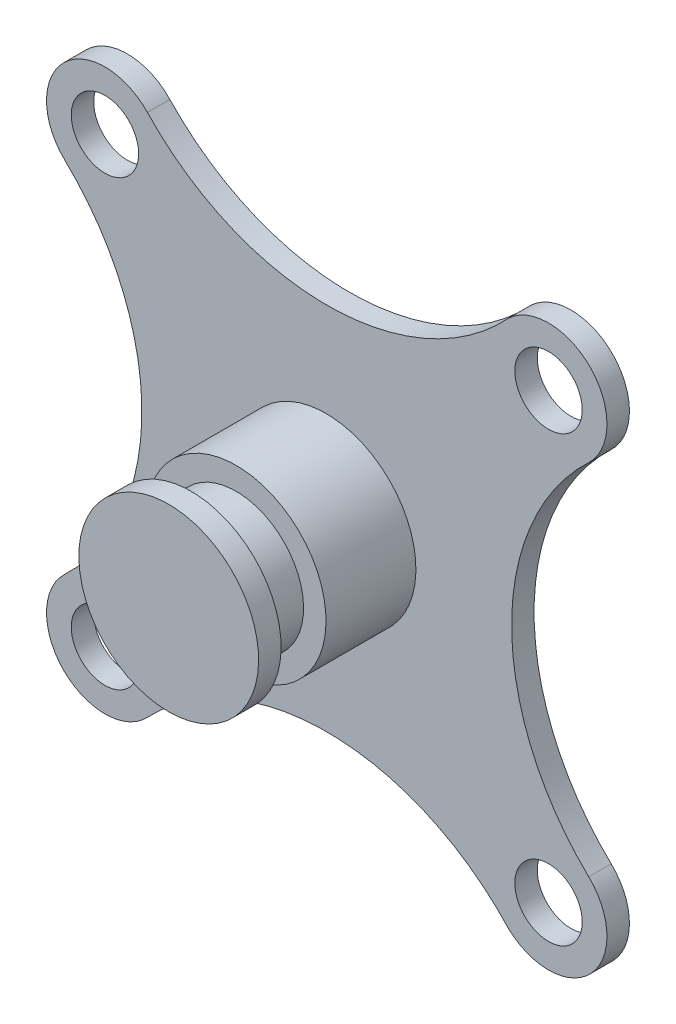
from build123d import *

# Parameters (mm, degrees)
SKETCH1_R             = 7.5
BOSS_EXTRUDE1_DEPTH   = 5
SKETCH3_R             = 20
BOSS_EXTRUDE2_DEPTH   = 20
SKETCH4_R             = 15
BOSS_EXTRUDE3_DEPTH   = 10
SKETCH5_R             = 20
BOSS_EXTRUDE4_DEPTH   = 5
BODY_MOVE_COPY1_ANGLE = 90


with BuildPart() as part:
    # Sketch1 → Boss-Extrude1 (new body)
    with BuildSketch(Plane(origin=(0, 0, 0), x_dir=(1, 0, 0), z_dir=(0, 1, 0))):
        with BuildLine():
            ThreePointArc((-39.749220484, 58.127463165), (-58.377062168, 58.381791069), (-58.131919931, 39.753826237))
            ThreePointArc((-58.131919931, 39.753826237), (-40.976062677, -0.15633362), (-58.131919931, -40.066493476))
            ThreePointArc((-58.131919931, -40.066493476), (-58.377062168, -58.694458308), (-39.749220484, -58.440130404))
            ThreePointArc((-39.749220484, -58.440130404), (0.58615995, -41.266091018), (40.663235765, -59.034561344))
            ThreePointArc((40.663235765, -59.034561344), (58.984188278, -58.390820393), (58.444979195, -40.066493476))
            ThreePointArc((58.444979195, -40.066493476), (41.289121941, -0.15633362), (58.444979195, 39.753826237))
            ThreePointArc((58.444979195, 39.753826237), (58.984188278, 58.078153154), (40.663235765, 58.721894105))
            ThreePointArc((40.663235765, 58.721894105), (0.58615995, 40.953423779), (-39.749220484, 58.127463165))
        make_face()
        with Locations(Location((-49.186940736, 49.187136748, 0), (0, 0, 270))):
            Circle(SKETCH1_R, mode=Mode.SUBTRACT)
        with Locations(Location((49.5, 49.187136748, 0), (0, 0, 270))):
            Circle(SKETCH1_R, mode=Mode.SUBTRACT)
        with Locations(Location((-49.186940736, -49.499803987, 0), (0, 0, 270))):
            Circle(SKETCH1_R, mode=Mode.SUBTRACT)
        with Locations(Location((49.5, -49.499803987, 0), (0, 0, 270))):
            Circle(SKETCH1_R, mode=Mode.SUBTRACT)
    extrude(amount=BOSS_EXTRUDE1_DEPTH)

    # Sketch3 → Boss-Extrude2 (add)
    with BuildSketch(Plane(origin=(0, 5, 0), x_dir=(1, 0, 0), z_dir=(0, 1, 0))):
        with Locations(Location((0, 0, 0), (0, 0, 270))):
            Circle(SKETCH3_R)
    extrude(amount=BOSS_EXTRUDE2_DEPTH)

    # Sketch4 → Boss-Extrude3 (add)
    with BuildSketch(Plane(origin=(0, 25, 0), x_dir=(1, 0, 0), z_dir=(0, 1, 0))):
        with Locations(Location((0, 0, 0), (0, 0, 270))):
            Circle(SKETCH4_R)
    extrude(amount=BOSS_EXTRUDE3_DEPTH)

    # Sketch5 → Boss-Extrude4 (add)
    with BuildSketch(Plane(origin=(0, 35, 0), x_dir=(1, 0, 0), z_dir=(0, 1, 0))):
        with Locations(Location((0, 0, 0), (0, 0, 270))):
            Circle(SKETCH5_R)
    extrude(amount=BOSS_EXTRUDE4_DEPTH)


with BuildPart() as part_1:
    # Body-Move/Copy1: read off the stored shape, not the designer's step
    # Body-Move/Copy1: moved
    add(part.part.moved(Location((0, -25, 0))).rotate(Axis((0, 0, 0), (1, 0, 0)), BODY_MOVE_COPY1_ANGLE))


solid = part_1.part
